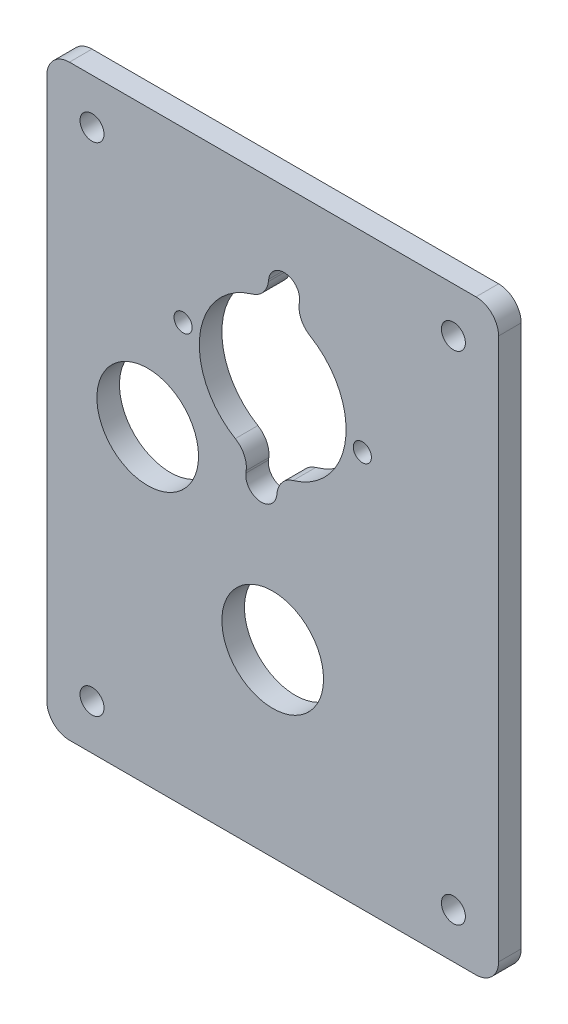
from build123d import *

# Parameters (mm, degrees)
SKETCH1_W           = 127
SKETCH1_H           = 165.1
SKETCH1_R           = 3.3734375
SKETCH1_R_2         = 14.2875
SKETCH1_R_3         = 2.5527
BOSS_EXTRUDE1_DEPTH = 6.35
FILLET1_R           = 6.35


with BuildPart() as part:
    # Sketch1 → Boss-Extrude1 (new body)
    with BuildSketch(Plane.XY):
        Rectangle(SKETCH1_W, SKETCH1_H)
        with Locations((-50.8, 69.85)):
            Circle(SKETCH1_R, mode=Mode.SUBTRACT)
        with Locations((50.8, 69.85)):
            Circle(SKETCH1_R, mode=Mode.SUBTRACT)
        with Locations((50.8, -69.85)):
            Circle(SKETCH1_R, mode=Mode.SUBTRACT)
        with Locations((-50.8, -69.85)):
            Circle(SKETCH1_R, mode=Mode.SUBTRACT)
        with Locations((0, -31.952201006)):
            Circle(SKETCH1_R_2, mode=Mode.SUBTRACT)
        with Locations((-35.1409, 4.732361785)):
            Circle(SKETCH1_R_2, mode=Mode.SUBTRACT)
        with Locations((25.197543761, 28.751609125)):
            Circle(SKETCH1_R_3, mode=Mode.SUBTRACT)
        with Locations((-25.197543761, 35.152792887)):
            Circle(SKETCH1_R_3, mode=Mode.SUBTRACT)
        with BuildLine():
            Line((-7.534569408, 7.305159048), (-7.454878346, 7.932548946))
            ThreePointArc((-7.454878346, 7.932548946), (-8.049848215, 11.522345151), (-10.517966807, 14.196109643))
            ThreePointArc((-10.517966807, 14.196109643), (-20.473004306, 34.552681909), (-5.744824378, 51.773992023))
            ThreePointArc((-5.744824378, 51.773992023), (-2.686624737, 53.7458036), (-1.213076708, 57.072856673))
            Line((-1.213076708, 57.072856673), (-1.133385646, 57.700246571))
            ThreePointArc((-1.133385646, 57.700246571), (3.751093684, 61.483722294), (7.534569408, 56.599242964))
            Line((7.534569408, 56.599242964), (7.454878346, 55.971853066))
            ThreePointArc((7.454878346, 55.971853066), (8.049848215, 52.38205686), (10.517966807, 49.708292369))
            ThreePointArc((10.517966807, 49.708292369), (20.473004306, 29.351720103), (5.744824378, 12.130409989))
            ThreePointArc((5.744824378, 12.130409989), (2.686624737, 10.158598412), (1.213076708, 6.831545339))
            Line((1.213076708, 6.831545339), (1.133385646, 6.204155441))
            ThreePointArc((1.133385646, 6.204155441), (-3.751093684, 2.420679717), (-7.534569408, 7.305159048))
        make_face(mode=Mode.SUBTRACT)
    extrude(amount=BOSS_EXTRUDE1_DEPTH)

    # Fillet1
    fillet1_edges = [part.edges().sort_by_distance(p)[0] for p in [
        (-63.5, 82.55, 3.175),
        (-63.5, -82.55, 3.175),
        (63.5, -82.55, 3.175),
        (63.5, 82.55, 3.175),
    ]]
    fillet(fillet1_edges, radius=FILLET1_R)


solid = part.part
